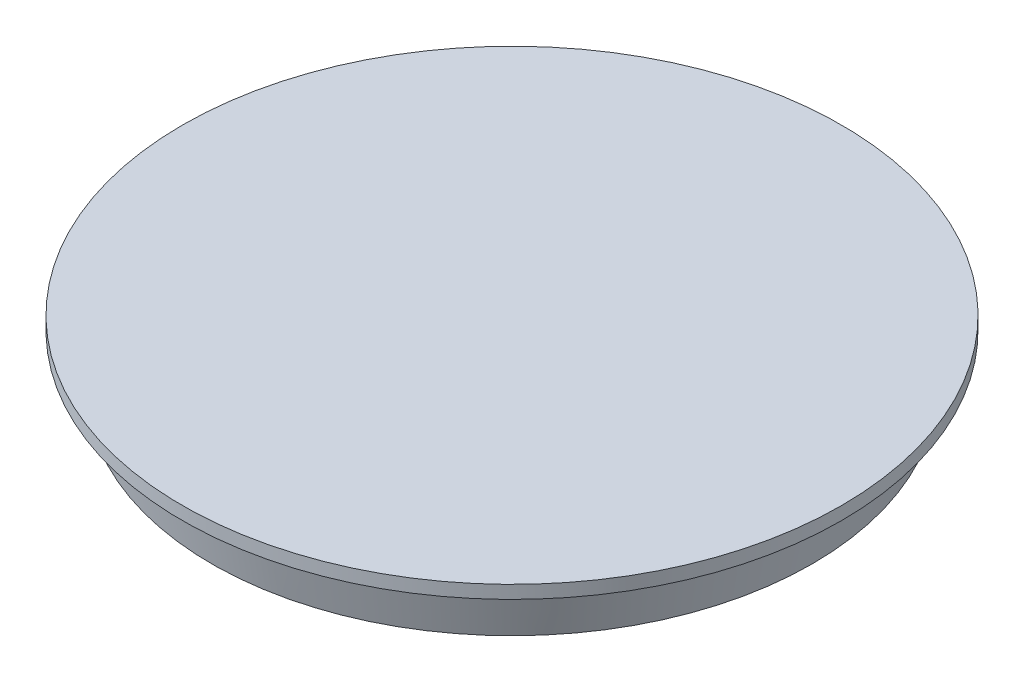
from build123d import *

# Parameters (mm, degrees)
FILLET1_R = 4


with BuildPart() as part:
    # Sketch2 → Revolve3 (revolve)
    with BuildSketch(Plane.XY):
        Polygon((22, -5), (22, -1), (0, -1), (0, 0), (25.25, 0), (25.25, -1), (23.75, -1), (23, -5), align=None)
    revolve(axis=Axis((0, -1, 0), (0, 1, 0)))

    # Fillet1
    fillet1_edges = [part.edges().sort_by_distance(p)[0] for p in [
        (-22, -1, 0),
    ]]
    fillet(fillet1_edges, radius=FILLET1_R - 0.0001)  # a hair under: the kernel refuses the full size


solid = part.part
